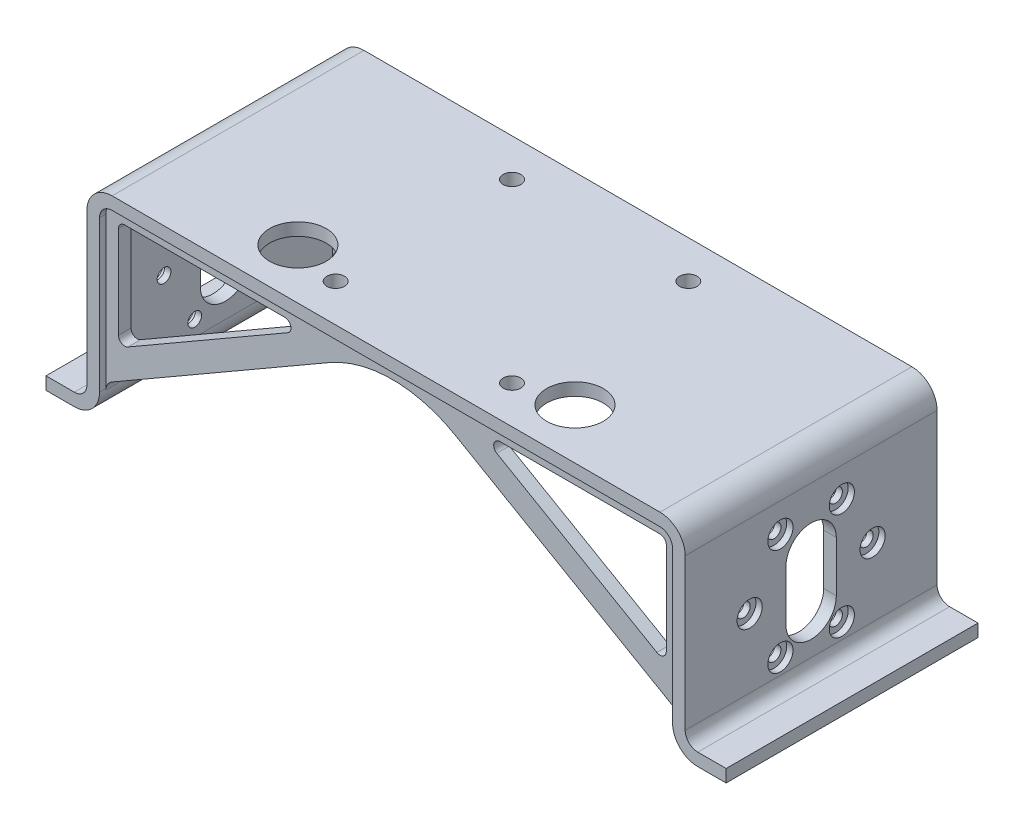
from build123d import *

# Parameters (mm, degrees)
BOSS_EXTRU_1_DEPTH                              = 31.75
CONG_1_R                                        = 6.35
CONG_2_R                                        = 3.175
ESQUISSE4_R                                     = 7.14375
ESQUISSE4_R_2                                   = 2.2225
ENL_V_MAT_EXTRU_1_DEPTH                         = 105.582398734
CHAMBRAGE_POUR_VIS_T_TE_CYLINDRIQUE_D           = 3.4544
CHAMBRAGE_POUR_VIS_T_TE_CYLINDRIQUE_DEPTH       = 3.175
CHAMBRAGE_POUR_VIS_T_TE_CYLINDRIQUE_CBORE_D     = 6.35
CHAMBRAGE_POUR_VIS_T_TE_CYLINDRIQUE_CBORE_DEPTH = 1.5875
R_P_T_START                                     = -75.40625
R_P_T_PAR_COURBE1_OUTLINE_R                     = 3.175
R_P_T_PAR_COURBE1_DEPTH                         = 1.5875
R_P_T_START_2                                   = -73.81875
R_P_T_PAR_COURBE1_2_OUTLINE_R                   = 1.7272
R_P_T_PAR_COURBE1_2_DEPTH                       = 1.5875
ENL_V_MAT_EXTRU_4_REACH                         = 173.907
BOSS_EXTRU_2_START                              = -3.175
BOSS_EXTRU_2_DEPTH                              = 3.175
CONG_3_R                                        = 1.5875
CONG_3_OF_SYM_TRIE2_R                           = 1.5875
CONG_4_R                                        = 3.175


# Read off the part's stored shape, not the designer's step: Répét. par courbe1
with BuildPart() as part:
    # Esquisse3 → Boss.-Extru.1 (new, symmetric)
    with BuildSketch(Plane.XY):
        Polygon((-75.40625, 0), (75.40625, 0), (75.40625, -47.625), (85.725, -47.625), (85.725, -50.8), (72.23125, -50.8), (72.23125, -3.175), (-72.23125, -3.175), (-72.23125, -50.8), (-85.725, -50.8), (-85.725, -47.625), (-75.40625, -47.625), align=None)
    extrude(amount=BOSS_EXTRU_1_DEPTH, both=True)

    # Congé1
    cong_1_edges = [part.edges().sort_by_distance(p)[0] for p in [
        (72.23125, -50.8, 0),
        (-72.23125, -50.8, 0),
        (-75.40625, 0, 0),
        (75.40625, 0, 0),
    ]]
    fillet(cong_1_edges, radius=CONG_1_R)

    # Congé2
    cong_2_edges = [part.edges().sort_by_distance(p)[0] for p in [
        (75.40625, -47.625, 0),
        (72.23125, -3.175, 0),
        (-72.23125, -3.175, 0),
        (-75.40625, -47.625, 0),
    ]]
    fillet(cong_2_edges, radius=CONG_2_R)

    # Esquisse4 → Enlèv. mat.-Extru.1 (cut, through all)
    with BuildSketch(Plane(origin=(0, 0, 0), x_dir=(1, 0, 0), z_dir=(0, 1, 0))):
        with Locations(Location((-34.925, -19.05, 0), (0, 0, 270))):
            Circle(ESQUISSE4_R)
        with Locations(Location((-22.225, -22.225, 0), (0, 0, 270))):
            Circle(ESQUISSE4_R_2)
        with Locations(Location((22.225, -22.225, 0), (0, 0, 270))):
            Circle(ESQUISSE4_R_2)
        with Locations(Location((34.925, -19.05, 0), (0, 0, 270))):
            Circle(ESQUISSE4_R)
        with Locations(Location((22.225, 22.225, 0), (0, 0, 270))):
            Circle(ESQUISSE4_R_2)
        with Locations(Location((-22.225, 22.225, 0), (0, 0, 270))):
            Circle(ESQUISSE4_R_2)
    extrude(amount=-ENL_V_MAT_EXTRU_1_DEPTH, mode=Mode.SUBTRACT)

    # Chambrage pour vis à tête cylindrique à 6 pans creux (vis CHC) #54
    with Locations(Plane.ZY.offset(75.40625)):
        with Locations((-15.494, -27.1018)):
            chambrage_pour_vis_t_te_cylindrique = CounterBoreHole(CHAMBRAGE_POUR_VIS_T_TE_CYLINDRIQUE_D / 2, CHAMBRAGE_POUR_VIS_T_TE_CYLINDRIQUE_CBORE_D / 2, CHAMBRAGE_POUR_VIS_T_TE_CYLINDRIQUE_CBORE_DEPTH, depth=CHAMBRAGE_POUR_VIS_T_TE_CYLINDRIQUE_DEPTH)

    # Répét. par courbe1 outline → Répét. par courbe1 (cut)
    with BuildSketch(Plane.YZ.offset(R_P_T_START)):
        with Locations((-40.519997606, -7.747)):
            Circle(R_P_T_PAR_COURBE1_OUTLINE_R)
        with Locations((-40.519997606, 7.747)):
            Circle(R_P_T_PAR_COURBE1_OUTLINE_R)
        with Locations((-27.1018, 15.494)):
            Circle(R_P_T_PAR_COURBE1_OUTLINE_R)
        with Locations((-13.683602394, 7.747)):
            Circle(R_P_T_PAR_COURBE1_OUTLINE_R)
        with Locations((-13.683602394, -7.747)):
            Circle(R_P_T_PAR_COURBE1_OUTLINE_R)
    r_p_t_par_courbe1 = extrude(amount=R_P_T_PAR_COURBE1_DEPTH, mode=Mode.SUBTRACT)

    # R_p_t. par courbe1 2 outline → R_p_t. par courbe1 2 (cut)
    with BuildSketch(Plane.YZ.offset(R_P_T_START_2)):
        with Locations((-40.519997606, -7.747)):
            Circle(R_P_T_PAR_COURBE1_2_OUTLINE_R)
        with Locations((-40.519997606, 7.747)):
            Circle(R_P_T_PAR_COURBE1_2_OUTLINE_R)
        with Locations((-27.1018, 15.494)):
            Circle(R_P_T_PAR_COURBE1_2_OUTLINE_R)
        with Locations((-13.683602394, 7.747)):
            Circle(R_P_T_PAR_COURBE1_2_OUTLINE_R)
        with Locations((-13.683602394, -7.747)):
            Circle(R_P_T_PAR_COURBE1_2_OUTLINE_R)
    r_p_t_par_courbe1_2 = extrude(amount=R_P_T_PAR_COURBE1_2_DEPTH, mode=Mode.SUBTRACT)

    # Esquisse6 → Enlèv. mat.-Extru.4 (cut, up to next)
    with BuildSketch(Plane.ZY.offset(75.40625), mode=Mode.PRIVATE) as enl_v_mat_extru_4_sk1:
        with BuildLine():
            Line((6.35, -21.4122), (6.35, -34.1122))
            ThreePointArc((6.35, -34.1122), (0, -40.4622), (-6.35, -34.1122))
            Line((-6.35, -34.1122), (-6.35, -21.4122))
            ThreePointArc((-6.35, -21.4122), (0, -15.0622), (6.35, -21.4122))
        make_face()
    enl_v_mat_extru_4_tool1 = extrude(enl_v_mat_extru_4_sk1.sketch, amount=-ENL_V_MAT_EXTRU_4_REACH, mode=Mode.PRIVATE) & part.part
    enl_v_mat_extru_4 = enl_v_mat_extru_4_tool1.solids().sort_by_distance((-75.40625, -27.7622, 0))[0]
    add(enl_v_mat_extru_4, mode=Mode.SUBTRACT)

    # Symétrie1: Chambrage pour vis à tête cylindrique à 6 pans creux (vis CHC) #54, Répét. par courbe1, R_p_t. par courbe1 2, Enlèv. mat.-Extru.4 across plane
    add(chambrage_pour_vis_t_te_cylindrique.mirror(Plane(origin=(0, 0, 0), x_dir=(0, 0, 1), z_dir=(1, 0, 0))), mode=Mode.SUBTRACT)
    add(r_p_t_par_courbe1.mirror(Plane(origin=(0, 0, 0), x_dir=(0, 0, 1), z_dir=(1, 0, 0))), mode=Mode.SUBTRACT)
    add(r_p_t_par_courbe1_2.mirror(Plane(origin=(0, 0, 0), x_dir=(0, 0, 1), z_dir=(1, 0, 0))), mode=Mode.SUBTRACT)
    add(enl_v_mat_extru_4.mirror(Plane(origin=(0, 0, 0), x_dir=(0, 0, 1), z_dir=(1, 0, 0))), mode=Mode.SUBTRACT)

    # Esquisse26 → Boss.-Extru.2 (add)
    with BuildSketch(Plane.XY.offset(30.1625).offset(BOSS_EXTRU_2_START)):
        with BuildLine():
            Line((-15.875, -10.60369343), (-72.23125, -43.140989538))
            Line((-72.23125, -43.140989538), (-72.23125, -6.35))
            ThreePointArc((-72.23125, -6.35), (-71.30131403, -4.10493597), (-69.05625, -3.175))
            Line((-69.05625, -3.175), (69.05625, -3.175))
            ThreePointArc((69.05625, -3.175), (71.30131403, -4.10493597), (72.23125, -6.35))
            Line((72.23125, -6.35), (72.23125, -43.140989538))
            Line((72.23125, -43.140989538), (15.875, -10.60369343))
            ThreePointArc((15.875, -10.60369343), (0, -6.35), (-15.875, -10.60369343))
        make_face()
        Polygon((-69.05625, -6.35), (-21.20738686, -6.35), (-69.05625, -33.975554014), align=None, mode=Mode.SUBTRACT)
        Polygon((21.20738686, -6.35), (69.05625, -33.975554014), (69.05625, -6.35), align=None, mode=Mode.SUBTRACT)
    boss_extru_2 = extrude(amount=BOSS_EXTRU_2_DEPTH)

    # Congé3
    cong_3_edges = [part.edges().sort_by_distance(p)[0] for p in [
        (-69.05625, -6.35, 28.575),
        (-21.20738686, -6.35, 28.575),
        (-69.05625, -33.975554014, 28.575),
        (69.05625, -6.35, 28.575),
        (69.05625, -33.975554014, 28.575),
        (21.20738686, -6.35, 28.575),
    ]]
    fillet(cong_3_edges, radius=CONG_3_R)

    # Symétrie2: Boss.-Extru.2 across plane
    add(boss_extru_2.mirror(Plane.XY))

    # Congé3 of Symétrie2
    cong_3_of_sym_trie2_edges = [part.edges().sort_by_distance(p)[0] for p in [
        (-69.05625, -6.35, -28.575),
        (-21.20738686, -6.35, -28.575),
        (-69.05625, -33.975554014, -28.575),
        (69.05625, -6.35, -28.575),
        (69.05625, -33.975554014, -28.575),
        (21.20738686, -6.35, -28.575),
    ]]
    fillet(cong_3_of_sym_trie2_edges, radius=CONG_3_OF_SYM_TRIE2_R)

    # Congé4
    # the kernel refuses this fillet: 3.175 mm, written as the material it adds along each edge
    with BuildSketch(Plane(origin=(-72.23125, -43.140989538, 26.9875), x_dir=(-0.005971670671685116, -0.9999821694157295, 0), z_dir=(0, 0, 1)), Plane(origin=(72.23125, -43.140989538, -26.9875), x_dir=(0.0059716706716850905, -0.9999821694157296, 0), z_dir=(0, 0, -1))) as cong_4_piece_1:
        with BuildLine():
            CenterArc((1.822789642, 3.171034898), CONG_4_R, 210.34215356, 56.794076382)
            Line((-0.91731196, 1.567143316), (-1.191322121, 1.406754157))
            Line((-1.191322121, 1.406754157), (-0.27401016, -0.160389158))
            Line((-0.27401016, -0.160389158), (0.001896005, -0.317494339))
            ThreePointArc((0.001896005, -0.317494339), (1.310883127, -0.309677359), (1.648299424, -0.31710349))
            Line((1.648299424, -0.31710349), (1.664162171, 0))
        make_face()
    extrude(amount=3.175)
    with BuildSketch(Plane(origin=(72.23125, -43.140989538, 26.9875), x_dir=(0.0059716706716850905, -0.9999821694157296, 0), z_dir=(0, 0, 1))) as cong_4_piece_2:
        with BuildLine():
            CenterArc((1.822789642, -3.171034898), CONG_4_R, 92.863770058, 56.794076382)
            Line((-0.91731196, -1.567143316), (-1.191322121, -1.406754157))
            Line((-1.191322121, -1.406754157), (-0.27401016, 0.160389158))
            Line((-0.27401016, 0.160389158), (0.001896005, 0.317494339))
            ThreePointArc((0.001896005, 0.317494339), (1.310883127, 0.309677359), (1.648299424, 0.31710349))
            Line((1.648299424, 0.31710349), (1.664162171, 0))
        make_face()
    extrude(amount=3.175)
    with BuildSketch(Plane(origin=(-72.23125, -43.140989538, -26.9875), x_dir=(0.8660254037844383, 0.5000000000000007, 0), z_dir=(0, 0, -1))) as cong_4_piece_3:
        with BuildLine():
            CenterArc((1.815874281, 3.175), CONG_4_R, 213.205923618, 56.794076382)
            Line((-0.840672661, 1.436212105), (-1.106327355, 1.262333315))
            ThreePointArc((-1.106327355, 1.262333315), (-0.929468297, 0.974886314), (-0.274963066, -0.15875))
            Line((-0.274963066, -0.15875), (0, -0.3175))
            Line((0, -0.3175), (1.815874281, -0.3175))
            Line((1.815874281, -0.3175), (1.815874281, 0))
        make_face()
    extrude(amount=3.175)


solid = part.part
